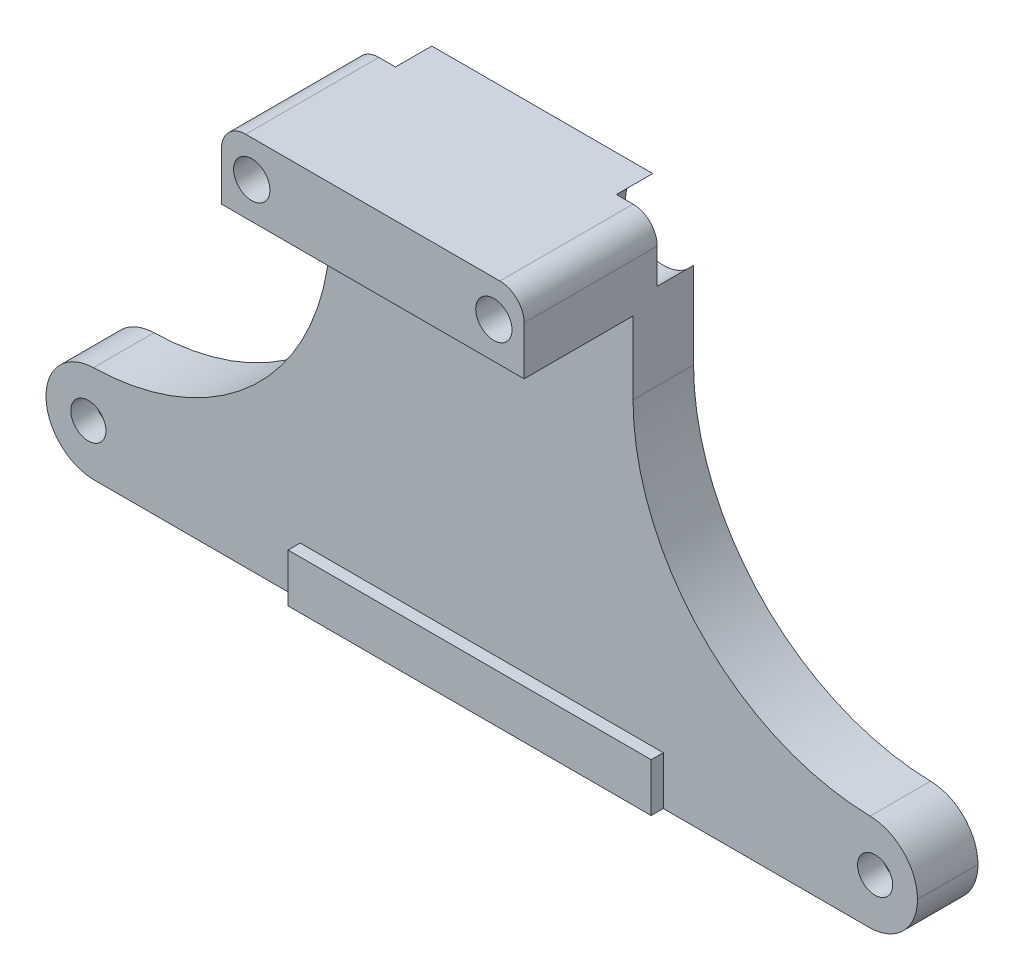
from build123d import *

# Parameters (mm, degrees)
SKETCH_1_W          = 72
SKETCH_1_H          = 8
SKETCH_1_R          = 1.45
EXTRUDE_1_DEPTH     = 5
SKETCH_2_W          = 25
SKETCH_2_H          = 32
SKETCH_2_R          = 1.5
EXTRUDE_2_DEPTH     = 5
SKETCH_3_W          = 25
SKETCH_3_H          = 6
SKETCH_3_R          = 1.5
EXTRUDE_3_DEPTH     = 9
FILLET_1_R          = 20
FILLET_2_R          = 4
FILLET_3_R          = 2
SKETCH_4_R          = 3.125
CUT_EXTRUDE_3_DEPTH = 3
SKETCH_5_W          = 30
SKETCH_5_H          = 4
EXTRUDE_4_DEPTH     = 1


with BuildPart() as part:
    # Эскиз1 → Бобышка-Вытянуть1 (new body)
    with BuildSketch(Plane.XY):
        Rectangle(SKETCH_1_W, SKETCH_1_H)
        with Locations((-32.5, 0)):
            Circle(SKETCH_1_R, mode=Mode.SUBTRACT)
        with Locations((32.5, 0)):
            Circle(SKETCH_1_R, mode=Mode.SUBTRACT)
    extrude(amount=EXTRUDE_1_DEPTH)

    # Эскиз2 → Бобышка-Вытянуть2 (add)
    with BuildSketch(Plane(origin=(0, 0, 0), x_dir=(-1, 0, 0), z_dir=(0, 0, -1))):
        with Locations((0, 20)):
            Rectangle(SKETCH_2_W, SKETCH_2_H)
        with Locations((-10, 33)):
            Circle(SKETCH_2_R, mode=Mode.SUBTRACT)
        with Locations((10, 33)):
            Circle(SKETCH_2_R, mode=Mode.SUBTRACT)
    extrude(amount=-EXTRUDE_2_DEPTH)

    # Эскиз3 → Бобышка-Вытянуть3 (add)
    with BuildSketch(Plane(origin=(0, 0, 5), x_dir=(-1, 0, 0), z_dir=(0, 0, -1))):
        with Locations((0, 33)):
            Rectangle(SKETCH_3_W, SKETCH_3_H)
        with Locations((10, 33)):
            Circle(SKETCH_3_R, mode=Mode.SUBTRACT)
        with Locations((-10, 33)):
            Circle(SKETCH_3_R, mode=Mode.SUBTRACT)
    extrude(amount=-EXTRUDE_3_DEPTH)

    # Скругление1
    fillet_1_edges = [part.edges().sort_by_distance(p)[0] for p in [
        (12.5, 4, 2.5),
        (-12.5, 4, 2.5),
    ]]
    fillet(fillet_1_edges, radius=FILLET_1_R)

    # Скругление2
    fillet_2_edges = [part.edges().sort_by_distance(p)[0] for p in [
        (-36, -4, 2.5),
        (-36, 4, 2.5),
        (36, -4, 2.5),
        (36, 4, 2.5),
    ]]
    fillet(fillet_2_edges, radius=FILLET_2_R)

    # Скругление3
    fillet_3_edges = [part.edges().sort_by_distance(p)[0] for p in [
        (12.5, 36, 7),
        (-12.5, 36, 7),
    ]]
    fillet(fillet_3_edges, radius=FILLET_3_R)

    # Эскиз4 → Вырез-Вытянуть3 (cut)
    with BuildSketch(Plane(origin=(0, 0, 0), x_dir=(-1, 0, 0), z_dir=(0, 0, -1))):
        with Locations((-10, 33)):
            Circle(SKETCH_4_R)
        with Locations((10, 33)):
            Circle(SKETCH_4_R)
        with Locations((-32.5, 0)):
            Circle(SKETCH_4_R)
        with Locations((32.5, 0)):
            Circle(SKETCH_4_R)
    extrude(amount=-CUT_EXTRUDE_3_DEPTH, mode=Mode.SUBTRACT)

    # Эскиз5 → Бобышка-Вытянуть4 (add)
    with BuildSketch(Plane.XY.offset(5)):
        with Locations((0, -2)):
            Rectangle(SKETCH_5_W, SKETCH_5_H)
    extrude(amount=EXTRUDE_4_DEPTH)


solid = part.part
